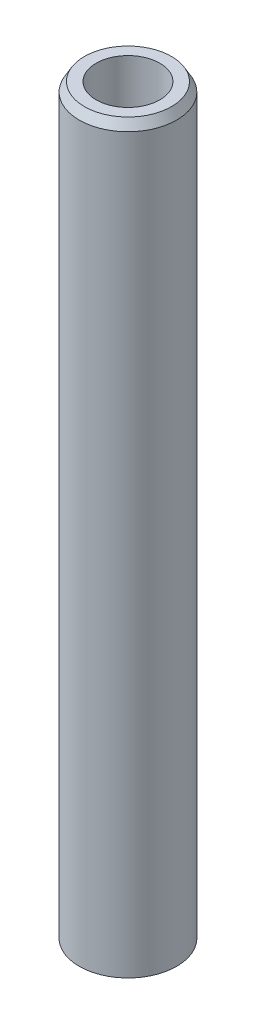
from build123d import *
from OCP.BRepFilletAPI import BRepFilletAPI_MakeChamfer

# Parameters (mm, degrees)
SKETCH1_R           = 17.5
BOSS_EXTRUDE1_DEPTH = 268.285741237
SKETCH2_R           = 11.423648286
CUT_EXTRUDE1_DEPTH  = 270.424829871
CHAMFER1_SIZE       = 3.24785876
CHAMFER1_SIZE2      = 1.875152129


with BuildPart() as part:
    # Sketch1 → Boss-Extrude1 (new body)
    with BuildSketch(Plane(origin=(0, 0, 0), x_dir=(1, 0, 0), z_dir=(0, 1, 0))):
        Circle(SKETCH1_R)
    extrude(amount=BOSS_EXTRUDE1_DEPTH)

    # Sketch2 → Cut-Extrude1 (cut, through all)
    with BuildSketch(Plane(origin=(0, 0, 0), x_dir=(1, 0, 0), z_dir=(0, 1, 0))):
        Circle(SKETCH2_R)
    extrude(amount=CUT_EXTRUDE1_DEPTH, mode=Mode.SUBTRACT)

    # Chamfer1: one chamfer whose edges measure the first distance from different faces: ONE call of the kernel's chamfer builder (chamfer() names one face for all edges)
    chamfer1_edges_1 = [part.edges().sort_by_distance(p)[0] for p in [
        (-17.5, 268.285741237, 0),
    ]]
    chamfer1_side_1 = [part.faces().sort_by_distance(p)[0] for p in [
        (-17.5, 134.142870618, 0),
    ]]
    chamfer1_edges_2 = [part.edges().sort_by_distance(p)[0] for p in [
        (-17.5, 0, 0),
    ]]
    chamfer1_side_2 = [part.faces().sort_by_distance(p)[0] for p in [
        (-17.005025253, 0, 0),
    ]]
    chamfer1 = BRepFilletAPI_MakeChamfer(part.part.solid().wrapped)
    for e in chamfer1_edges_1:
        chamfer1.Add(CHAMFER1_SIZE, CHAMFER1_SIZE2, e.wrapped, chamfer1_side_1[0].wrapped)  # the first distance lies on this face
    for e in chamfer1_edges_2:
        chamfer1.Add(CHAMFER1_SIZE, CHAMFER1_SIZE2, e.wrapped, chamfer1_side_2[0].wrapped)  # the first distance lies on this face
    add(Compound.cast(chamfer1.Shape()), mode=Mode.REPLACE)


solid = part.part
